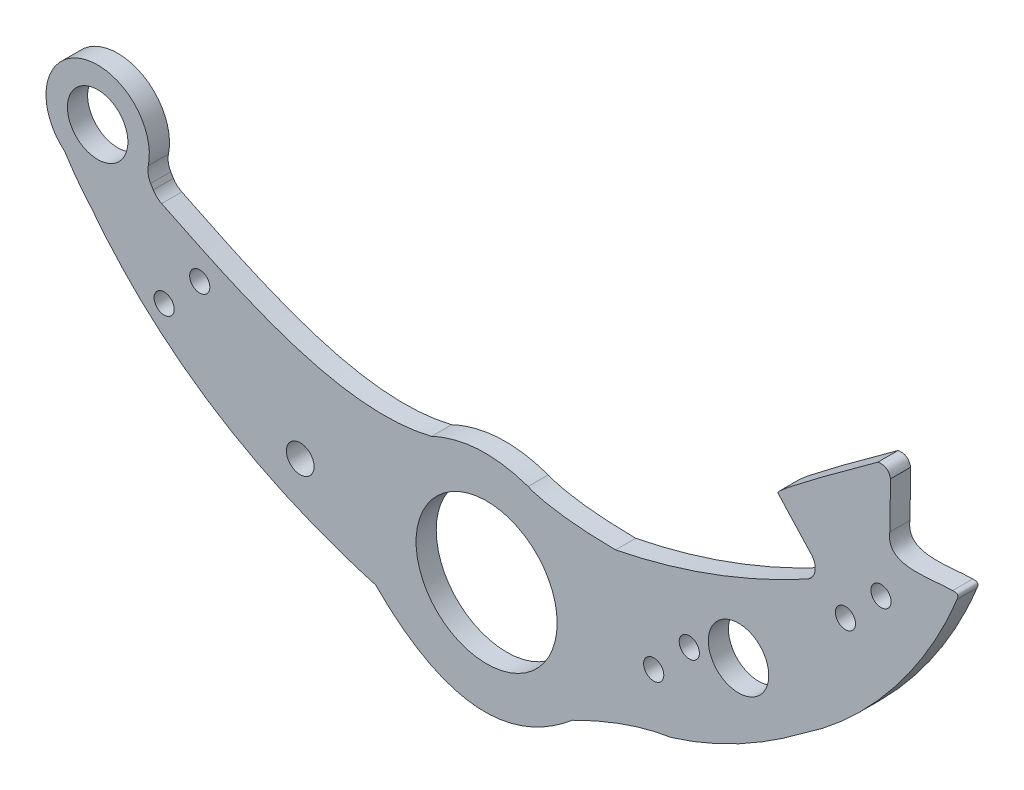
from build123d import *

# Parameters (mm, degrees)
MODEL_R               = 4.250003312
MODEL_R_2             = 2.750739051
MODEL_R_3             = 2
TABAN_FLAN_1_DEPTH    = 4
IZIM1_W               = 33.261087109
IZIM1_H               = 28.852991227
SEKME1_DEPTH          = 4
IZIM4_R               = 14
KES_EKSTR_ZYON1_DEPTH = 10
IZIM5_R               = 6
KES_EKSTR_ZYON2_DEPTH = 10
RADYUS1_R             = 3
IZIM6_R               = 10.255106093
IZIM6_R_2             = 3.797139687
SEKME2_DEPTH          = 4
IZIM9_R               = 6
KES_EKSTR_ZYON3_DEPTH = 10
RADYUS2_R             = 4


# Sheet-metal steps are written as plain solids
with BuildPart() as part:
    # Model → Taban-Flanş1 (new body)
    with BuildSketch(Plane.XY):
        with BuildLine():
            add(Edge.make_bspline(
                [(3109.63786856, 2115.37754708), (3122.91316856, 2098.00144708), (3141.75296856, 2085.65664708), (3166.15706856, 2078.66474708)],
                knots=[0, 0, 0, 0, 0.026315789, 0.026315789, 0.026315789, 0.026315789], degree=3))
            add(Edge.make_bspline(
                [(3166.15706856, 2078.66474708), (3179.36946856, 2065.40354708), (3192.38586856, 2064.16554708), (3205.20626856, 2074.95084708)],
                knots=[0.052631579, 0.052631579, 0.052631579, 0.052631579, 0.078947368, 0.078947368, 0.078947368, 0.078947368], degree=3))
            add(Edge.make_bspline(
                [(3205.20626856, 2074.95084708), (3212.44426856, 2078.61404708), (3218.99666856, 2080.89554708), (3224.86356856, 2081.79514708)],
                knots=[0.105263158, 0.105263158, 0.105263158, 0.105263158, 0.131578947, 0.131578947, 0.131578947, 0.131578947], degree=3))
            add(Edge.make_bspline(
                [(3224.86356856, 2081.79514708), (3233.64336856, 2084.49734708), (3242.39766856, 2089.13084708), (3251.12626856, 2095.69584708)],
                knots=[0.157894737, 0.157894737, 0.157894737, 0.157894737, 0.184210526, 0.184210526, 0.184210526, 0.184210526], degree=3))
            add(Edge.make_bspline(
                [(3251.12626856, 2095.69584708), (3263.93226856, 2104.28284708), (3275.34806856, 2118.40454708), (3281.50066856, 2133.81654708)],
                knots=[0.210526316, 0.210526316, 0.210526316, 0.210526316, 0.236842105, 0.236842105, 0.236842105, 0.236842105], degree=3))
            add(Edge.make_bspline(
                [(3281.50066856, 2133.81654708), (3281.95096856, 2134.68714708), (3281.66796856, 2135.06734708), (3280.65166856, 2134.95694708)],
                knots=[0.263157895, 0.263157895, 0.263157895, 0.263157895, 0.289473684, 0.289473684, 0.289473684, 0.289473684], degree=3))
            add(Edge.make_bspline(
                [(3280.65166856, 2134.95694708), (3276.72366856, 2135.05064708), (3267.28426856, 2132.56494708), (3268.20996856, 2138.83004708)],
                knots=[0.315789474, 0.315789474, 0.315789474, 0.315789474, 0.342105263, 0.342105263, 0.342105263, 0.342105263], degree=3))
            add(Edge.make_bspline(
                [(3268.20996856, 2138.83004708), (3268.29816856, 2144.94904708), (3268.34226856, 2148.00864708)],
                knots=[0.368421053, 0.368421053, 0.368421053, 0.394736842, 0.394736842, 0.394736842], degree=2))
            add(Edge.make_bspline(
                [(3268.34226856, 2148.00864708), (3268.05746856, 2149.32424708), (3267.22186856, 2149.86364708), (3265.83536856, 2149.62684708)],
                knots=[0.421052632, 0.421052632, 0.421052632, 0.421052632, 0.447368421, 0.447368421, 0.447368421, 0.447368421], degree=3))
            add(Edge.make_bspline(
                [(3265.83536856, 2149.62684708), (3252.29706856, 2139.83354708), (3245.67386856, 2134.76664708), (3245.96566856, 2134.42624708)],
                knots=[0.473684211, 0.473684211, 0.473684211, 0.473684211, 0.5, 0.5, 0.5, 0.5], degree=3))
            add(Edge.make_bspline(
                [(3245.96566856, 2134.42624708), (3252.10236856, 2127.74094708), (3255.17056856, 2124.39824708)],
                knots=[0.526315789, 0.526315789, 0.526315789, 0.552631579, 0.552631579, 0.552631579], degree=2))
            add(Edge.make_bspline(
                [(3255.17056856, 2124.39824708), (3241.72096856, 2116.62674708), (3227.91756856, 2111.32994708), (3213.76056856, 2108.50784708)],
                knots=[0.578947368, 0.578947368, 0.578947368, 0.578947368, 0.605263158, 0.605263158, 0.605263158, 0.605263158], degree=3))
            add(Edge.make_bspline(
                [(3213.76056856, 2108.50784708), (3203.77946856, 2108.56904708), (3198.07446856, 2109.89254708), (3196.41116856, 2110.73614708)],
                knots=[0.631578947, 0.631578947, 0.631578947, 0.631578947, 0.657894737, 0.657894737, 0.657894737, 0.657894737], degree=3))
            add(Edge.make_bspline(
                [(3196.41116856, 2110.73614708), (3189.81546856, 2113.01174708), (3183.42196856, 2112.68434708), (3177.23076856, 2109.75424708)],
                knots=[0.684210526, 0.684210526, 0.684210526, 0.684210526, 0.710526316, 0.710526316, 0.710526316, 0.710526316], degree=3))
            add(Edge.make_bspline(
                [(3177.23076856, 2109.75424708), (3158.79236856, 2105.21744708), (3138.82946856, 2115.68974708), (3122.63636856, 2123.49564708)],
                knots=[0.736842105, 0.736842105, 0.736842105, 0.736842105, 0.763157895, 0.763157895, 0.763157895, 0.763157895], degree=3))
            add(Edge.make_bspline(
                [(3122.63636856, 2123.49564708), (3121.05686856, 2125.98834708), (3120.33186856, 2127.40314708), (3120.46116856, 2127.73984708)],
                knots=[0.789473684, 0.789473684, 0.789473684, 0.789473684, 0.815789474, 0.815789474, 0.815789474, 0.815789474], degree=3))
            add(Edge.make_bspline(
                [(3120.46116856, 2127.73984708), (3120.65286856, 2134.03014708), (3118.79596856, 2137.76174708), (3114.89056856, 2138.93464708)],
                knots=[0.842105263, 0.842105263, 0.842105263, 0.842105263, 0.868421053, 0.868421053, 0.868421053, 0.868421053], degree=3))
            add(Edge.make_bspline(
                [(3114.89056856, 2138.93464708), (3107.86456856, 2140.79974708), (3103.26626856, 2138.32384708), (3101.09596856, 2131.50664708)],
                knots=[0.894736842, 0.894736842, 0.894736842, 0.894736842, 0.921052632, 0.921052632, 0.921052632, 0.921052632], degree=3))
            add(Edge.make_bspline(
                [(3101.09596856, 2131.50664708), (3101.31076856, 2127.06704708), (3104.15806856, 2121.69074708), (3109.63786856, 2115.37754708)],
                knots=[0.947368421, 0.947368421, 0.947368421, 0.947368421, 1, 1, 1, 1], degree=3))
        make_face()
        with Locations((3110.978473341, 2130.220867466)):
            Circle(MODEL_R, mode=Mode.SUBTRACT)
        with Locations((3151.181278155, 2092.882262914)):
            Circle(MODEL_R_2, mode=Mode.SUBTRACT)
        with Locations((3131.238292653, 2113.390554749)):
            Circle(MODEL_R_3, mode=Mode.SUBTRACT)
        with Locations((3124.175950785, 2106.066377098)):
            Circle(MODEL_R_3, mode=Mode.SUBTRACT)
        with Locations((3266.454212243, 2126.936459372)):
            Circle(MODEL_R_3, mode=Mode.SUBTRACT)
        with Locations((3259.391870375, 2119.612281721)):
            Circle(MODEL_R_3, mode=Mode.SUBTRACT)
        with Locations((3228.404290977, 2099.075593739)):
            Circle(MODEL_R_3, mode=Mode.SUBTRACT)
        with Locations((3221.341949109, 2091.751416088)):
            Circle(MODEL_R_3, mode=Mode.SUBTRACT)
        with BuildLine():
            add(Edge.make_bspline(
                [(3202.10906856, 2089.91944708), (3202.10906856, 2097.65144708), (3195.84106856, 2103.91944708), (3188.10906856, 2103.91944708)],
                knots=[0, 0, 0, 0, 0.2, 0.2, 0.2, 0.2], degree=3))
            add(Edge.make_bspline(
                [(3188.10906856, 2103.91944708), (3180.37706856, 2103.91954708), (3174.10906856, 2097.65154708), (3174.10906856, 2089.91954708)],
                knots=[0.2, 0.2, 0.2, 0.2, 0.4, 0.4, 0.4, 0.4], degree=3))
            add(Edge.make_bspline(
                [(3174.10906856, 2089.91954708), (3174.10906856, 2082.18754708), (3180.37696856, 2075.91954708), (3188.10896856, 2075.91944708)],
                knots=[0.4, 0.4, 0.4, 0.4, 0.6, 0.6, 0.6, 0.6], degree=3))
            add(Edge.make_bspline(
                [(3188.10896856, 2075.91944708), (3195.84096856, 2075.91944708), (3202.10896856, 2082.18744708), (3202.10906856, 2089.91944708)],
                knots=[0.6, 0.6, 0.6, 0.6, 1, 1, 1, 1], degree=3))
        make_face(mode=Mode.SUBTRACT)
    extrude(amount=-TABAN_FLAN_1_DEPTH)

    # Çizim1 → Sekme1 (add)
    with BuildSketch(Plane.XY):
        with Locations((3187.445358668, 2090.033249542)):
            Rectangle(IZIM1_W, IZIM1_H)
    extrude(amount=-SEKME1_DEPTH)

    # Çizim4 → Kes-Ekstrüzyon1 (cut)
    with BuildSketch(Plane.XY):
        with Locations((3188.176183509, 2090.122283307)):
            Circle(IZIM4_R)
    extrude(amount=-KES_EKSTR_ZYON1_DEPTH, mode=Mode.SUBTRACT)

    # Çizim5 → Kes-Ekstrüzyon2 (cut)
    with BuildSketch(Plane(origin=(0, 0, -4), x_dir=(-1, 0, 0), z_dir=(0, 0, -1))):
        with Locations((-3238.176183509, 2102.122283307)):
            Circle(IZIM5_R)
    extrude(amount=-KES_EKSTR_ZYON2_DEPTH, mode=Mode.SUBTRACT)

    # Radyus1
    radyus1_edges = [part.edges().sort_by_distance(p)[0] for p in [
        (3255.17056856, 2124.39824708, -2),
    ]]
    fillet(radyus1_edges, radius=RADYUS1_R)

    # Çizim6 → Sekme2 (add)
    with BuildSketch(Plane(origin=(0, 0, -4), x_dir=(-1, 0, 0), z_dir=(0, 0, -1))):
        with Locations((-3110.978473341, 2130.220867466)):
            Circle(IZIM6_R)
        with Locations((-3110.978473341, 2130.220867466)):
            Circle(IZIM6_R_2, mode=Mode.SUBTRACT)
    extrude(amount=-SEKME2_DEPTH)

    # Çizim9 → Kes-Ekstrüzyon3 (cut)
    with BuildSketch(Plane(origin=(0, 0, -4), x_dir=(-1, 0, 0), z_dir=(0, 0, -1))):
        with Locations((-3110.978473341, 2130.220867466)):
            Circle(IZIM9_R)
    extrude(amount=-KES_EKSTR_ZYON3_DEPTH, mode=Mode.SUBTRACT)

    # Radyus2
    radyus2_edges = [part.edges().sort_by_distance(p)[0] for p in [
        (3122.63636856, 2123.49564708, -2),
        (3120.680098466, 2126.897364658, -2),
    ]]
    fillet(radyus2_edges, radius=RADYUS2_R)


solid = part.part
